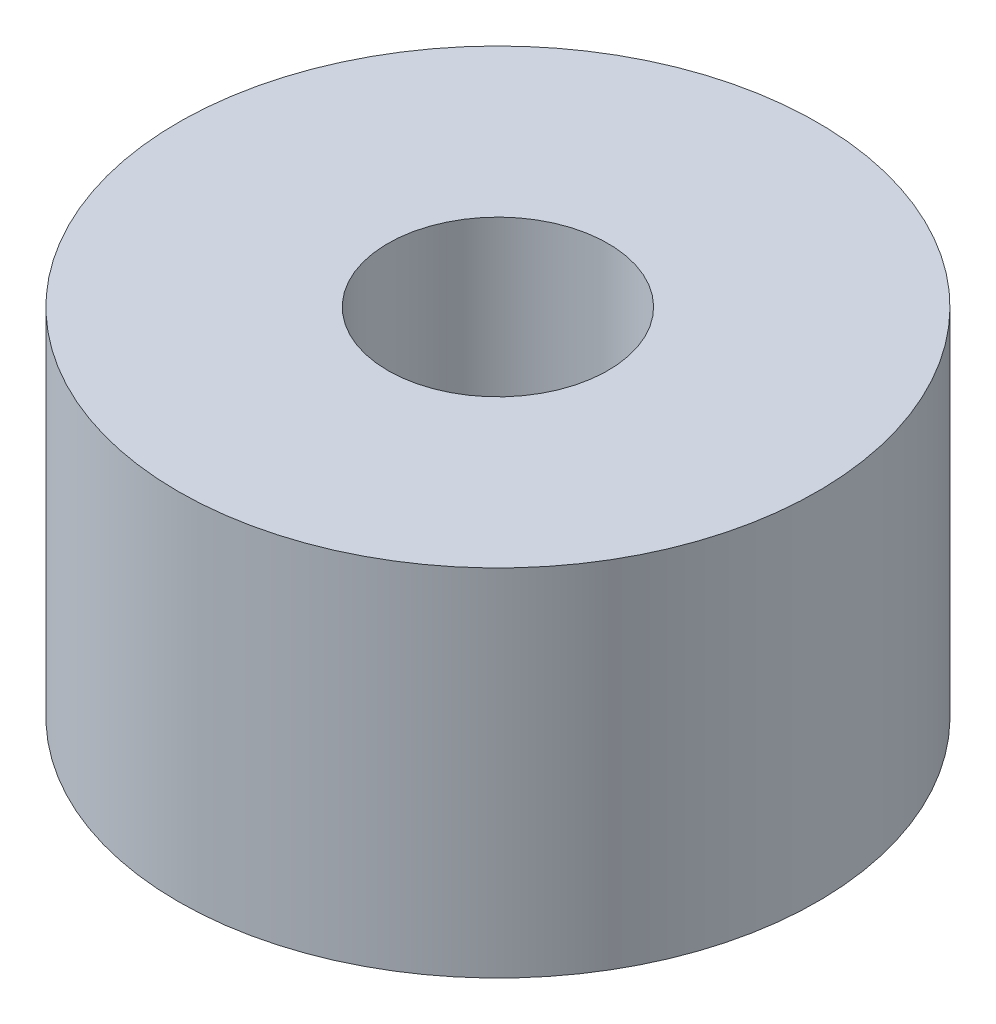
from build123d import *

# Parameters (mm, degrees)
SKETCH1_R           = 4.5
SKETCH1_R_2         = 1.55
BOSS_EXTRUDE1_DEPTH = 5


with BuildPart() as part:
    # Sketch1 → Boss-Extrude1 (new body)
    with BuildSketch(Plane(origin=(0, 0, 0), x_dir=(1, 0, 0), z_dir=(0, 1, 0))):
        Circle(SKETCH1_R)
        Circle(SKETCH1_R_2, mode=Mode.SUBTRACT)
    extrude(amount=BOSS_EXTRUDE1_DEPTH)


solid = part.part
